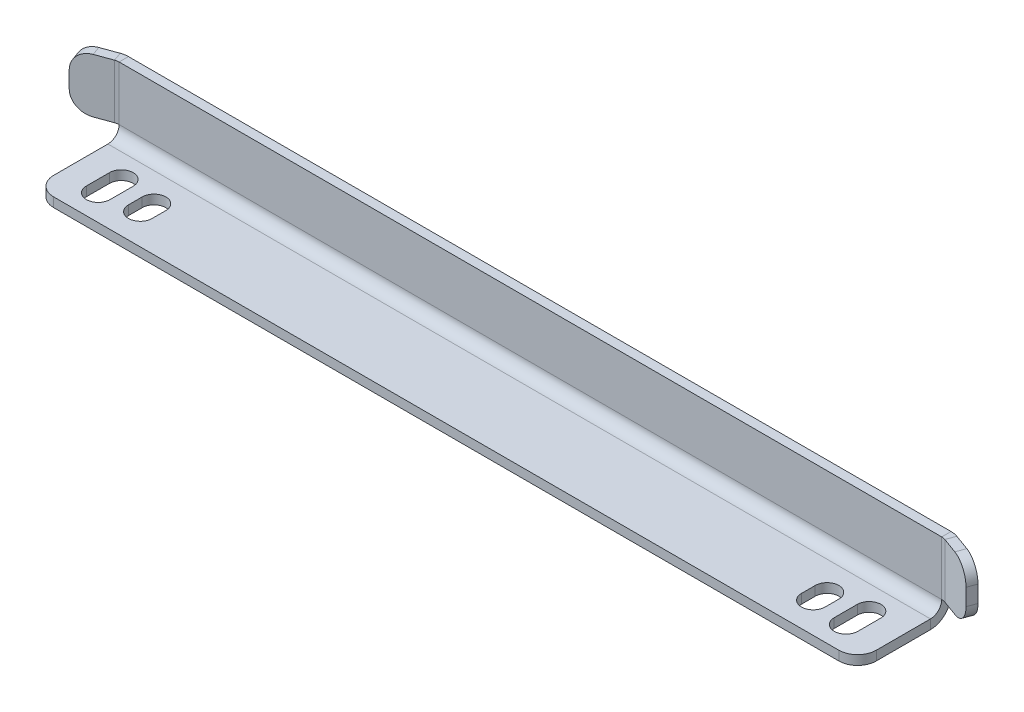
from build123d import *

# Parameters (mm, degrees)
SKETCH3_W                    = 279.4
SKETCH3_H                    = 31.75
BASE_FLANGE1_DEPTH           = 3.175
EDGE_FLANGE1_STRIP_W         = 20.32
EDGE_FLANGE1_STRIP_H         = 3.175
EDGE_FLANGE1_STRIP_CUT_DEPTH = 279.4
EDGE_FLANGE1_DEPTH           = 279.4
EDGE_FLANGE2_DEPTH           = 18.415
EDGE_FLANGE3_DEPTH           = 18.415
FILLET1_R                    = 6.35
O_0_316_DIAMETER_SLOT2_DEPTH = 3.175
O_0_316_DIAMETER_SLOT1_DEPTH = 3.175


# Read off the part's stored shape, not the designer's step: O (0.316) Diameter Slot2, O (0.316) Diameter Slot1
# Sheet-metal steps are written as plain solids
with BuildPart() as part:
    # Sketch3 → Base-Flange1 (new body)
    with BuildSketch(Plane(origin=(0, 0, 0), x_dir=(1, 0, 0), z_dir=(0, 1, 0))):
        with Locations((-139.7, -15.875)):
            Rectangle(SKETCH3_W, SKETCH3_H)
    extrude(amount=BASE_FLANGE1_DEPTH)

    # Edge-Flange1 strip (across the edge) → Edge-Flange1 strip cut (cut)
    with BuildSketch(Plane(origin=(0, 3.175, 0), x_dir=(0, 0, 1), z_dir=(-1, 0, 0))):
        with Locations((-3.175, -1.5875)):
            Rectangle(EDGE_FLANGE1_STRIP_W, EDGE_FLANGE1_STRIP_H)
    extrude(amount=EDGE_FLANGE1_STRIP_CUT_DEPTH, mode=Mode.SUBTRACT)

    # Edge-Flange1 section (across the edge) → Edge-Flange1 (add)
    with BuildSketch(Plane(origin=(0, 3.175, 0), x_dir=(0, 0, 1), z_dir=(-1, 0, 0))):
        with BuildLine():
            Line((0, 3.81), (0, 22.225))
            Line((0, 22.225), (3.175, 22.225))
            Line((3.175, 22.225), (3.175, 3.81))
            ThreePointArc((3.175, 3.81), (4.290923164, 1.115923164), (6.985, 0))
            Line((6.985, 0), (6.985, -3.175))
            ThreePointArc((6.985, -3.175), (2.045859133, -1.129140867), (0, 3.81))
        make_face()
    extrude(amount=EDGE_FLANGE1_DEPTH)

    # Edge-Flange2 section (across the edge) → Edge-Flange2 (add)
    with BuildSketch(Plane(origin=(0.671805796, 6.985, 3.175), x_dir=(-0.3420201433256631, 2.7658990361859502e-15, 0.9396926207859105), z_dir=(0, 1, 0))):
        with BuildLine():
            Line((-3.175, 0.671805796), (-3.175, 12.7))
            Line((-3.175, 12.7), (0, 12.7))
            Line((0, 12.7), (0, 0.671805796))
            ThreePointArc((0, 0.671805796), (0.057882461, 0.01020624), (0.229771115, -0.63129095))
            Line((0.229771115, -0.63129095), (-2.753752956, -1.717204905))
            ThreePointArc((-2.753752956, -1.717204905), (-3.068882155, -0.541126725), (-3.175, 0.671805796))
        make_face()
    extrude(amount=EDGE_FLANGE2_DEPTH)

    # Edge-Flange3 section (across the edge) → Edge-Flange3 (add)
    with BuildSketch(Plane(origin=(-280.071805796, 25.4, 3.175), x_dir=(0.3420201433256631, 1.2835487003775482e-15, 0.9396926207859105), z_dir=(0, -1, 0))):
        with BuildLine():
            Line((-3.175, 0.671805796), (-3.175, 12.7))
            Line((-3.175, 12.7), (0, 12.7))
            Line((0, 12.7), (0, 0.671805796))
            ThreePointArc((0, 0.671805796), (0.057882461, 0.01020624), (0.229771115, -0.63129095))
            Line((0.229771115, -0.63129095), (-2.753752956, -1.717204905))
            ThreePointArc((-2.753752956, -1.717204905), (-3.068882155, -0.541126725), (-3.175, 0.671805796))
        make_face()
    extrude(amount=EDGE_FLANGE3_DEPTH)

    # Fillet1
    fillet1_edges = [part.edges().sort_by_distance(p)[0] for p in [
        (13.148859058, 6.985, 6.026893785),
        (13.148859058, 25.4, 6.026893785),
        (-292.548859058, 25.4, 6.026893785),
        (-292.548859058, 6.985, 6.026893785),
        (0, 1.5875, 31.75),
        (-279.4, 1.5875, 31.75),
    ]]
    fillet(fillet1_edges, radius=FILLET1_R)

    # O (0.316) Diameter Slot2 outline → O (0.316) Diameter Slot2 (cut)
    with BuildSketch(Plane(origin=(0, 0, 0), x_dir=(1, 0, 0), z_dir=(0, 1, 0))):
        with BuildLine():
            Line((-29.4132, -16.7132), (-29.4132, -21.3868))
            ThreePointArc((-29.4132, -21.3868), (-25.4, -25.4), (-21.3868, -21.3868))
            Line((-21.3868, -21.3868), (-21.3868, -16.7132))
            ThreePointArc((-21.3868, -16.7132), (-25.4, -12.7), (-29.4132, -16.7132))
        make_face()
        with BuildLine():
            Line((-258.0132, -16.7132), (-258.0132, -21.3868))
            ThreePointArc((-258.0132, -21.3868), (-254, -25.4), (-249.9868, -21.3868))
            Line((-249.9868, -21.3868), (-249.9868, -16.7132))
            ThreePointArc((-249.9868, -16.7132), (-254, -12.7), (-258.0132, -16.7132))
        make_face()
    extrude(amount=O_0_316_DIAMETER_SLOT2_DEPTH, mode=Mode.SUBTRACT)

    # O (0.316) Diameter Slot1 outline → O (0.316) Diameter Slot1 (cut)
    with BuildSketch(Plane(origin=(0, 0, 0), x_dir=(1, 0, 0), z_dir=(0, 1, 0))):
        with BuildLine():
            Line((-16.7132, -15.1257), (-16.7132, -22.9743))
            ThreePointArc((-16.7132, -22.9743), (-12.7, -26.9875), (-8.6868, -22.9743))
            Line((-8.6868, -22.9743), (-8.6868, -15.1257))
            ThreePointArc((-8.6868, -15.1257), (-12.7, -11.1125), (-16.7132, -15.1257))
        make_face()
        with BuildLine():
            Line((-270.7132, -15.1257), (-270.7132, -22.9743))
            ThreePointArc((-270.7132, -22.9743), (-266.7, -26.9875), (-262.6868, -22.9743))
            Line((-262.6868, -22.9743), (-262.6868, -15.1257))
            ThreePointArc((-262.6868, -15.1257), (-266.7, -11.1125), (-270.7132, -15.1257))
        make_face()
    extrude(amount=O_0_316_DIAMETER_SLOT1_DEPTH, mode=Mode.SUBTRACT)


solid = part.part
